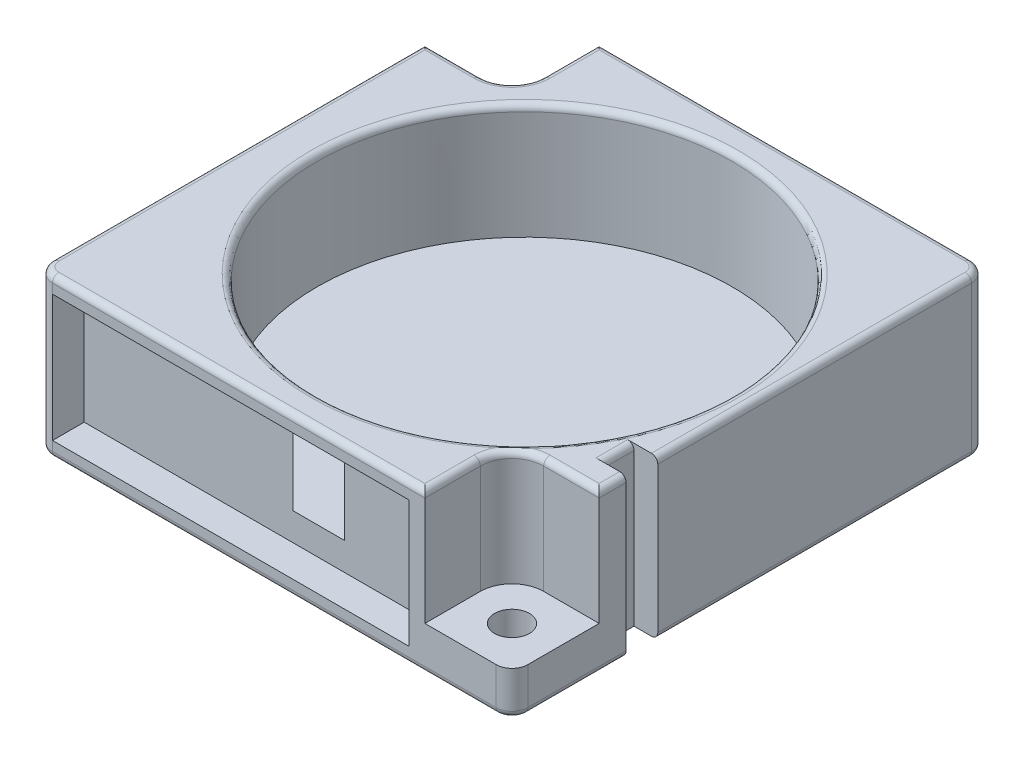
from build123d import *

# Parameters (mm, degrees)
SKETCH1_W           = 30
SKETCH1_H           = 30
BOSS_EXTRUDE1_DEPTH = 10
SKETCH2_W           = 5.5
SKETCH2_H           = 5.5
CUT_EXTRUDE1_DEPTH  = 7.25
FILLET1_R           = 2
SKETCH3_R           = 13.1
CUT_EXTRUDE2_DEPTH  = 7.25
SKETCH4_R           = 1.1
CUT_EXTRUDE3_DEPTH  = 44.041404485
SKETCH5_W           = 22.5
SKETCH5_H           = 8
CUT_EXTRUDE4_DEPTH  = 2
SKETCH6_W           = 2
SKETCH6_H           = 10
CUT_EXTRUDE5_DEPTH  = 1.5
FILLET2_R           = 1
FILLET3_R           = 0.4


# Some blends are built 0.0001 mm under size
with BuildPart() as part:
    # Sketch1 → Boss-Extrude1 (new body)
    with BuildSketch(Plane(origin=(0, 0, 0), x_dir=(1, 0, 0), z_dir=(0, 1, 0))):
        with Locations((15, -15)):
            Rectangle(SKETCH1_W, SKETCH1_H)
    extrude(amount=BOSS_EXTRUDE1_DEPTH)

    # Sketch2 → Cut-Extrude1 (cut)
    with BuildSketch(Plane(origin=(0, 10, 0), x_dir=(1, 0, 0), z_dir=(0, 1, 0))):
        with Locations((27.25, -27.25)):
            Rectangle(SKETCH2_W, SKETCH2_H)
        with Locations((2.75, -2.75)):
            Rectangle(SKETCH2_W, SKETCH2_H)
    extrude(amount=-CUT_EXTRUDE1_DEPTH, mode=Mode.SUBTRACT)

    # Fillet1
    fillet1_edges = [part.edges().sort_by_distance(p)[0] for p in [
        (24.5, 6.375, 24.5),
        (5.5, 6.375, 5.5),
    ]]
    fillet(fillet1_edges, radius=FILLET1_R)

    # Sketch3 → Cut-Extrude2 (cut)
    with BuildSketch(Plane(origin=(0, 10, 0), x_dir=(1, 0, 0), z_dir=(0, 1, 0))):
        with Locations(Location((15.8, -15, 0), (0, 0, 270))):
            Circle(SKETCH3_R)
    extrude(amount=-CUT_EXTRUDE2_DEPTH, mode=Mode.SUBTRACT)

    # Sketch4 → Cut-Extrude3 (cut, through all)
    with BuildSketch(Plane(origin=(0, 2.75, 0), x_dir=(1, 0, 0), z_dir=(0, 1, 0))):
        with Locations(Location((2.75, -2.75, 0), (0, 0, 270))):
            Circle(SKETCH4_R)
        with Locations(Location((27.25, -27.25, 0), (0, 0, 270))):
            Circle(SKETCH4_R)
    extrude(amount=-CUT_EXTRUDE3_DEPTH, mode=Mode.SUBTRACT)

    # Sketch5 → Cut-Extrude4 (cut)
    with BuildSketch(Plane.XY.offset(30)):
        with Locations((12.25, 5)):
            Rectangle(SKETCH5_W, SKETCH5_H)
    extrude(amount=-CUT_EXTRUDE4_DEPTH, mode=Mode.SUBTRACT)

    # Sketch6 → Cut-Extrude5 (cut)
    with BuildSketch(Plane(origin=(30, 0, 0), x_dir=(0, 0, -1), z_dir=(1, 0, 0))):
        with Locations((-21.8, 5)):
            Rectangle(SKETCH6_W, SKETCH6_H)
    extrude(amount=-CUT_EXTRUDE5_DEPTH, mode=Mode.SUBTRACT)

    # Fillet2
    fillet2_edges = [part.edges().sort_by_distance(p)[0] for p in [
        (30, 1.375, 30),
        (0, 1.375, 0),
        (30, 5, 0),
        (0, 5, 30),
    ]]
    fillet(fillet2_edges, radius=FILLET2_R - 0.0001)  # a hair under: the kernel refuses the full size

    # Fillet3
    # the kernel refuses this fillet: 0.4 mm, written as the material it takes off along each edge
    with BuildSketch(Plane(origin=(4.5, 10, 0), x_dir=(0, 0, 1), z_dir=(1, 0, 0)), Plane(origin=(25.5, 10, 30), x_dir=(0, 0, -1), z_dir=(-1, 0, 0)), Plane(origin=(0, 10, 29.0001), x_dir=(1, 0, 0), z_dir=(0, 0, -1))) as fillet3_piece_1:
        with BuildLine():
            CenterArc((FILLET3_R, FILLET3_R), FILLET3_R, 180, 90)
            Line((0, FILLET3_R), (0, 0))
            Line((0, 0), (FILLET3_R, 0))
        make_face()
    extrude(amount=24.5001, mode=Mode.SUBTRACT)
    with BuildSketch(Plane(origin=(0.9999, 0, 0), x_dir=(0, 1, 0), z_dir=(1, 0, 0)), Plane(origin=(29.0001, 0, 30), x_dir=(0, 1, 0), z_dir=(-1, 0, 0)), Plane(origin=(0, 0, 29.0001), x_dir=(0, 1, 0), z_dir=(0, 0, -1))) as fillet3_piece_2:
        with BuildLine():
            CenterArc((FILLET3_R, FILLET3_R), FILLET3_R, 180, 90)
            Line((0, FILLET3_R), (0, 0))
            Line((0, 0), (FILLET3_R, 0))
        make_face()
    extrude(amount=28.0002, mode=Mode.SUBTRACT)
    with BuildSketch(Plane(origin=(30, 0, 21.8), x_dir=(0, 1, 0), z_dir=(0, 0, 1))) as fillet3_piece_3:
        with BuildLine():
            CenterArc((FILLET3_R, FILLET3_R), FILLET3_R, 180, 90)
            Line((0, FILLET3_R), (0, 0))
            Line((0, 0), (FILLET3_R, 0))
        make_face()
    extrude(amount=7.2001, mode=Mode.SUBTRACT)
    with BuildSketch(Plane(origin=(0.9999, 0, 0.9999), x_dir=(-1, 0, 0), z_dir=(0, 0, 1))) as fillet3_piece_4:
        with BuildLine():
            CenterArc((0.9999 - FILLET3_R, -FILLET3_R), FILLET3_R, 0, 90)
            Line((0.9999, -FILLET3_R), (0.9999, 0))
            Line((0.9999, 0), (0.9999 - FILLET3_R, 0))
        make_face()
    revolve(axis=Axis((0.9999, 0, 0.9999), (0, -1, 0)), revolution_arc=90, mode=Mode.SUBTRACT)
    with BuildSketch(Plane(origin=(0.9999, 0, 29.0001), x_dir=(-1, 0, 0), z_dir=(0, 0, -1))) as fillet3_piece_5:
        with BuildLine():
            CenterArc((0.9999 - FILLET3_R, FILLET3_R), FILLET3_R, 270, 90)
            Line((0.9999 - FILLET3_R, 0), (0.9999, 0))
            Line((0.9999, 0), (0.9999, FILLET3_R))
        make_face()
    revolve(axis=Axis((0.9999, 0, 29.0001), (0, 1, 0)), revolution_arc=90, mode=Mode.SUBTRACT)
    with BuildSketch(Plane(origin=(29.0001, 0, 29.0001), x_dir=(0, 0, 1), z_dir=(-1, 0, 0))) as fillet3_piece_6:
        with BuildLine():
            CenterArc((0.9999 - FILLET3_R, FILLET3_R), FILLET3_R, 270, 90)
            Line((0.9999, FILLET3_R), (0.9999, 0))
            Line((0.9999, 0), (0.9999 - FILLET3_R, 0))
        make_face()
    revolve(axis=Axis((29.0001, 0, 29.0001), (0, 1, 0)), revolution_arc=90, mode=Mode.SUBTRACT)
    with BuildSketch(Plane(origin=(29.0001, 0, 0.9999), x_dir=(1, 0, 0), z_dir=(0, 0, 1))) as fillet3_piece_7:
        with BuildLine():
            CenterArc((0.9999 - FILLET3_R, FILLET3_R), FILLET3_R, 270, 90)
            Line((0.9999 - FILLET3_R, 0), (0.9999, 0))
            Line((0.9999, 0), (0.9999, FILLET3_R))
        make_face()
    revolve(axis=Axis((29.0001, 0, 0.9999), (0, 1, 0)), revolution_arc=90, mode=Mode.SUBTRACT)
    with BuildSketch(Plane(origin=(0.9999, 10, 29.0001), x_dir=(-1, 0, 0), z_dir=(0, 0, -1))) as fillet3_piece_8:
        with BuildLine():
            CenterArc((0.9999 - FILLET3_R, -FILLET3_R), FILLET3_R, 0, 90)
            Line((0.9999, -FILLET3_R), (0.9999, 0))
            Line((0.9999, 0), (0.9999 - FILLET3_R, 0))
        make_face()
    revolve(axis=Axis((0.9999, 10, 29.0001), (0, 1, 0)), revolution_arc=90, mode=Mode.SUBTRACT)
    with BuildSketch(Plane(origin=(29.0001, 10, 0.9999), x_dir=(1, 0, 0), z_dir=(0, 0, 1))) as fillet3_piece_9:
        with BuildLine():
            CenterArc((0.9999 - FILLET3_R, -FILLET3_R), FILLET3_R, 0, 90)
            Line((0.9999, -FILLET3_R), (0.9999, 0))
            Line((0.9999, 0), (0.9999 - FILLET3_R, 0))
        make_face()
    revolve(axis=Axis((29.0001, 10, 0.9999), (0, 1, 0)), revolution_arc=90, mode=Mode.SUBTRACT)
    with BuildSketch(Plane(origin=(30, 10, 21.8), x_dir=(-1, 0, 0), z_dir=(0, 0, 1))) as fillet3_piece_10:
        with BuildLine():
            CenterArc((FILLET3_R, FILLET3_R), FILLET3_R, 180, 90)
            Line((0, FILLET3_R), (0, 0))
            Line((0, 0), (FILLET3_R, 0))
        make_face()
    extrude(amount=3.7, mode=Mode.SUBTRACT)
    with BuildSketch(Plane(origin=(26.5, 10, 24.5), x_dir=(0, 0, -1), z_dir=(1, 0, 0)), Plane(origin=(3.5, 10, 5.5), x_dir=(0, 0, 1), z_dir=(-1, 0, 0)), Plane(origin=(5.5, 10, -1), x_dir=(1, 0, 0), z_dir=(0, 0, 1)), Plane(origin=(24.5, 10, 31), x_dir=(-1, 0, 0), z_dir=(0, 0, -1))) as fillet3_piece_11:
        with BuildLine():
            CenterArc((FILLET3_R, -FILLET3_R), FILLET3_R, 90, 90)
            Line((0, -FILLET3_R), (0, 0))
            Line((0, 0), (FILLET3_R, 0))
        make_face()
    extrude(amount=4.5, mode=Mode.SUBTRACT)
    with BuildSketch(Plane(origin=(3.5, 10, 3.5), x_dir=(1, 0, 0), z_dir=(0, 0, -1))) as fillet3_piece_12:
        with BuildLine():
            CenterArc((2 + FILLET3_R, FILLET3_R), FILLET3_R, 180, 90)
            Line((2, FILLET3_R), (2, 0))
            Line((2, 0), (2 + FILLET3_R, 0))
        make_face()
    revolve(axis=Axis((3.5, 10, 3.5), (0, -1, 0)), revolution_arc=90, mode=Mode.SUBTRACT)
    with BuildSketch(Plane(origin=(26.5, 10, 26.5), x_dir=(0, 0, -1), z_dir=(1, 0, 0))) as fillet3_piece_13:
        with BuildLine():
            CenterArc((2 + FILLET3_R, -FILLET3_R), FILLET3_R, 90, 90)
            Line((2, -FILLET3_R), (2, 0))
            Line((2, 0), (2 + FILLET3_R, 0))
        make_face()
    revolve(axis=Axis((26.5, 10, 26.5), (0, 1, 0)), revolution_arc=90, mode=Mode.SUBTRACT)
    with BuildSketch(Plane(origin=(15.8, 10, 15), x_dir=(0, 0, 1), z_dir=(-1, 0, 0))) as fillet3_piece_14:
        with BuildLine():
            CenterArc((13.1 + FILLET3_R, -FILLET3_R), FILLET3_R, 90, 90)
            Line((13.1, -FILLET3_R), (13.1, 0))
            Line((13.1, 0), (13.1 + FILLET3_R, 0))
        make_face()
    revolve(axis=Axis((15.8, 10, 15), (0, 1, 0)), mode=Mode.SUBTRACT)
    with BuildSketch(Plane(origin=(30, 0, 0.9999), x_dir=(0, 1, 0), z_dir=(0, 0, 1)), Plane(origin=(30, 10, 0.9999), x_dir=(-1, 0, 0), z_dir=(0, 0, 1))) as fillet3_piece_15:
        with BuildLine():
            CenterArc((FILLET3_R, FILLET3_R), FILLET3_R, 180, 90)
            Line((0, FILLET3_R), (0, 0))
            Line((0, 0), (FILLET3_R, 0))
        make_face()
    extrude(amount=20.8001, mode=Mode.SUBTRACT)
    with BuildSketch(Plane(origin=(28.5, 10, 20.8), x_dir=(-1, 0, 0), z_dir=(0, 0, 1))) as fillet3_piece_16:
        with BuildLine():
            CenterArc((FILLET3_R, FILLET3_R), FILLET3_R, 180, 90)
            Line((0, FILLET3_R), (0, 0))
            Line((0, 0), (FILLET3_R, 0))
        make_face()
    extrude(amount=2, mode=Mode.SUBTRACT)


solid = part.part
